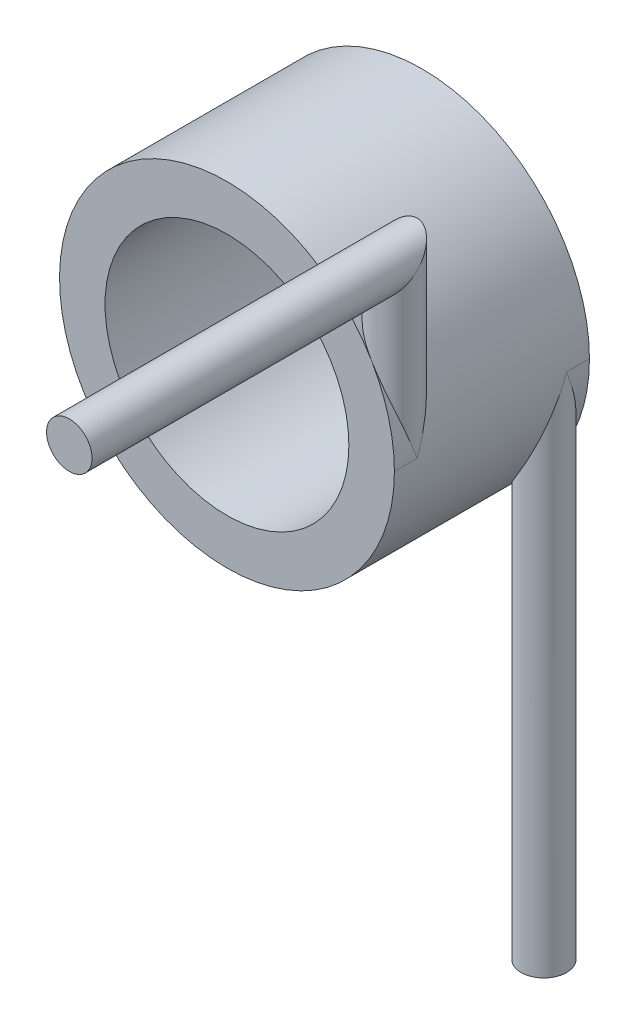
from build123d import *
from build123d.topology import SkipClean

# Parameters (mm, degrees)
SKETCH1_R           = 6.5405
SKETCH1_R_2         = 4.7625
BOSS_EXTRUDE1_DEPTH = 7.62
SKETCH2_R           = 0.889
BOSS_EXTRUDE2_DEPTH = 3.81
SKETCH2_3_R         = 0.889
BOSS_EXTRUDE3_DEPTH = 20.32
SKETCH7_R           = 0.889


with BuildPart() as part:
    # Sketch1 → Boss-Extrude1 (new body)
    with BuildSketch(Plane.XY):
        Circle(SKETCH1_R)
        Circle(SKETCH1_R_2, mode=Mode.SUBTRACT)
    extrude(amount=BOSS_EXTRUDE1_DEPTH)

    # Sketch2 → Boss-Extrude2 (add)
    with SkipClean():  # the faces are left unmerged after this step: merging them gives an invalid solid
        with BuildSketch(Plane(origin=(0, 0, 0), x_dir=(1, 0, 0), z_dir=(0, 1, 0))):
            with Locations((5.6515, -6.731)):
                Circle(SKETCH2_R)
        extrude(amount=BOSS_EXTRUDE2_DEPTH)

    # Sketch2<3> → Boss-Extrude3 (add)
    with SkipClean():  # the faces are left unmerged after this step: merging them gives an invalid solid
        with BuildSketch(Plane(origin=(0, 0, 0), x_dir=(1, 0, 0), z_dir=(0, 1, 0))):
            with Locations((5.6515, -0.889)):
                Circle(SKETCH2_3_R)
        extrude(amount=-BOSS_EXTRUDE3_DEPTH)
    add(part.part.scale(1), mode=Mode.REPLACE)  # the faces are merged on a copy

    # Sweep2: sweep along a path in Sketch8
    with SkipClean():  # the faces are left unmerged after this step: merging them gives an invalid solid
        with BuildLine(Plane(origin=(5.6515, 0, 0), x_dir=(0, 0, -1), z_dir=(1, 0, 0))) as sweep2_path:
            Line((-6.731, 3.81), (-6.731, 6.35))
            Line((-6.731, 6.35), (-19.431, 6.35))
        # Sketch7 → Sweep2 (sweep)
        with BuildSketch(Plane(origin=(0, 3.81, 0), x_dir=(1, 0, 0), z_dir=(0, 1, 0))):
            with Locations((5.6515, -6.731)):
                Circle(SKETCH7_R)
        sweep(path=sweep2_path.line, transition=Transition.RIGHT)


solid = part.part
